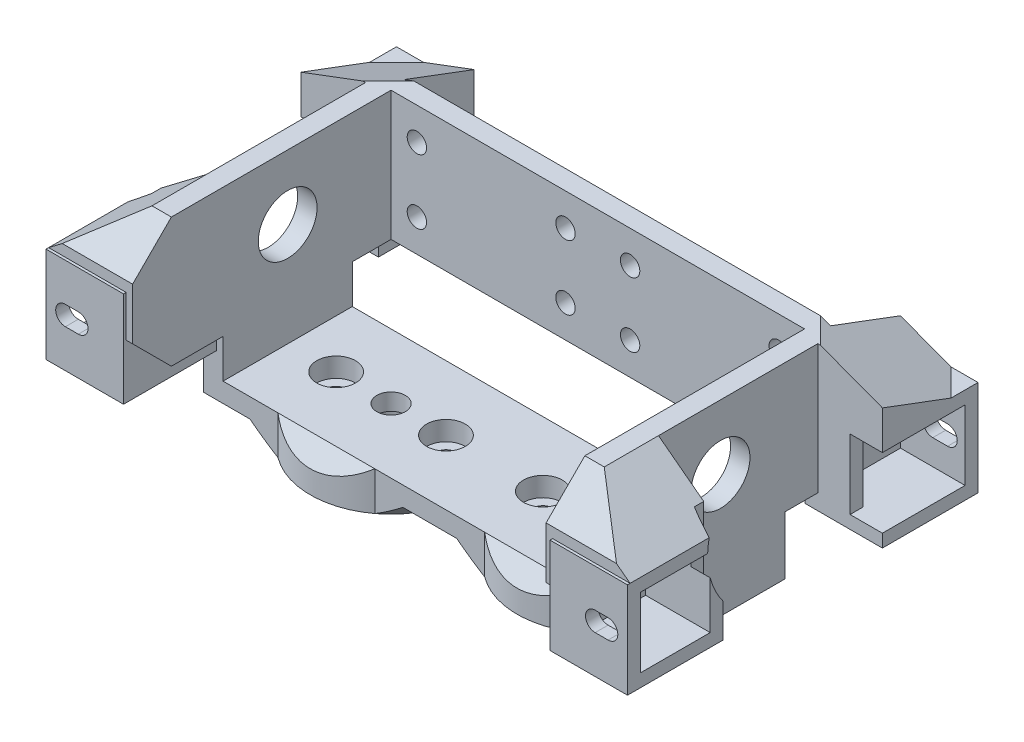
from build123d import *

# Parameters (mm, degrees)
SKETCH1_W            = 25
SKETCH1_H            = 20
BOSS_EXTRUDE1_DEPTH  = 3
SKETCH2_W            = 3
SKETCH2_H            = 20
BOSS_EXTRUDE2_DEPTH  = 40
SKETCH6_W            = 45
SKETCH6_H            = 20
BOSS_EXTRUDE3_DEPTH  = 3
SKETCH9_W            = 3
SKETCH9_H            = 20
BOSS_EXTRUDE4_DEPTH  = 40
SKETCH3_R            = 4.55
CUT_EXTRUDE1_DEPTH   = 83.758685345
CHAMFER1_SIZE        = 6
SKETCH17_W           = 14.8
SKETCH17_H           = 14.8
SKETCH17_W_2         = 10.8
SKETCH17_H_2         = 10.8
BOSS_EXTRUDE7_DEPTH  = 10
SKETCH18_W           = 14.8
SKETCH18_H           = 14.8
BOSS_EXTRUDE8_DEPTH  = 2
SKETCH21_W           = 14.8
SKETCH21_H           = 14.8
BOSS_EXTRUDE11_DEPTH = 2
BOSS_EXTRUDE12_REACH = 89.482
BOSS_EXTRUDE13_DEPTH = 7.6
CHAMFER4_SIZE        = 17
CHAMFER4_SIZE_2      = 9.039060338
CUT_EXTRUDE8_DEPTH   = 13
SKETCH26_R           = 12
CUT_EXTRUDE9_DEPTH   = 3
SKETCH27_W           = 2
SKETCH27_H           = 10.8
CUT_EXTRUDE10_DEPTH  = 3
CUT_EXTRUDE12_DEPTH  = 10
CUT_EXTRUDE13_START  = -10
CUT_EXTRUDE13_DEPTH  = 10
BOSS_EXTRUDE14_DEPTH = 3
SKETCH36_W           = 35
SKETCH36_H           = 20
SKETCH36_R           = 1.5
SKETCH36_R_2         = 2.2
BOSS_EXTRUDE15_DEPTH = 3
SKETCH37_R           = 12.5
SKETCH37_R_2         = 2.2
SKETCH37_R_3         = 1.5
BOSS_EXTRUDE16_DEPTH = 3
SKETCH38_R           = 3
CUT_EXTRUDE14_DEPTH  = 3
SKETCH39_R           = 3.7
CUT_EXTRUDE15_DEPTH  = 3.4
CHAMFER6_SIZE        = 3
CHAMFER7_SIZE        = 3
SKETCH40_W           = 2
SKETCH40_H           = 10.8
CUT_EXTRUDE16_DEPTH  = 2
SKETCH41_W           = 2
SKETCH41_H           = 10.8
CUT_EXTRUDE17_DEPTH  = 2
SKETCH50_R           = 1.5
CUT_EXTRUDE22_DEPTH  = 10


with BuildPart() as part:
    # Sketch1 → Boss-Extrude1 (new body)
    with BuildSketch(Plane.XY):
        Rectangle(SKETCH1_W, SKETCH1_H)
    extrude(amount=BOSS_EXTRUDE1_DEPTH)

    # Sketch2 → Boss-Extrude2 (add)
    with BuildSketch(Plane.XY.offset(3)):
        with Locations((-11, 0)):
            Rectangle(SKETCH2_W, SKETCH2_H)
    extrude(amount=BOSS_EXTRUDE2_DEPTH)

    # Sketch6 → Boss-Extrude3 (add)
    with BuildSketch(Plane(origin=(0, 0, 0), x_dir=(-1, 0, 0), z_dir=(0, 0, -1))):
        with Locations((-35, 0)):
            Rectangle(SKETCH6_W, SKETCH6_H)
    extrude(amount=-BOSS_EXTRUDE3_DEPTH)

    # Sketch9 → Boss-Extrude4 (add)
    with BuildSketch(Plane.XY.offset(3)):
        with Locations((56, 0)):
            Rectangle(SKETCH9_W, SKETCH9_H)
    extrude(amount=BOSS_EXTRUDE4_DEPTH)

    # Sketch3 → Cut-Extrude1 (cut, through all)
    with BuildSketch(Plane.ZY.offset(12.5)):
        with Locations(Location((19, 0, 0), (0, 0, 270))):
            Circle(SKETCH3_R)
    extrude(amount=-CUT_EXTRUDE1_DEPTH, mode=Mode.SUBTRACT)

    # Chamfer1
    chamfer1_edges = [part.edges().sort_by_distance(p)[0] for p in [
        (-11, -10, 43),
        (-11, 10, 43),
        (56, -10, 43),
        (56, 10, 43),
    ]]
    chamfer(chamfer1_edges, length=CHAMFER1_SIZE)

    # Sketch17 → Boss-Extrude7 (add)
    # profile 1 of 2: a face of its own
    with BuildSketch(Plane(origin=(57.5, 0, 0), x_dir=(0, 0, -1), z_dir=(1, 0, 0))):
        with Locations((3.445401219, -5)):
            Rectangle(SKETCH17_W, SKETCH17_H)
        with Locations((3.445401219, -5)):
            Rectangle(SKETCH17_W_2, SKETCH17_H_2, mode=Mode.SUBTRACT)
    # profile 2 of 2: a face of its own
    with BuildSketch(Plane(origin=(57.5, 0, 0), x_dir=(0, 0, -1), z_dir=(1, 0, 0))):
        with Locations((-36.004598781, -5)):
            Rectangle(SKETCH17_W, SKETCH17_H)
        with Locations((-36.004598781, -5)):
            Rectangle(SKETCH17_W_2, SKETCH17_H_2, mode=Mode.SUBTRACT)
    extrude(amount=BOSS_EXTRUDE7_DEPTH)

    # Sketch18 → Boss-Extrude8 (add)
    with BuildSketch(Plane.ZY.offset(-57.5)):
        with Locations((-3.445401219, -5)):
            Rectangle(SKETCH18_W, SKETCH18_H)
    extrude(amount=BOSS_EXTRUDE8_DEPTH)

    # Sketch21 → Boss-Extrude11 (add)
    with BuildSketch(Plane.ZY.offset(-57.5)):
        with Locations((36.004598781, -5)):
            Rectangle(SKETCH21_W, SKETCH21_H)
    extrude(amount=BOSS_EXTRUDE11_DEPTH)

    # Boss-Extrude12: up to this face of the body (flat: up to its plane)
    boss_extrude12_end = Plane(part.part.faces().sort_by_distance((62.311518325, -5.194764398, 28.604598781))[0])
    # Sketch22 → Boss-Extrude12 (add, up to the picked face)
    with BuildSketch(Plane.XY.offset(43.404598781), mode=Mode.PRIVATE) as boss_extrude12_sk1:
        Polygon((57.5, 2.4), (57.5, 10), (67.5, 2.4), align=None)
    boss_extrude12_tool1 = split(extrude(boss_extrude12_sk1.sketch, amount=-BOSS_EXTRUDE12_REACH, mode=Mode.PRIVATE), bisect_by=boss_extrude12_end, keep=Keep.BOTH, mode=Mode.PRIVATE)
    add(boss_extrude12_tool1.solids().sort_by(Axis((60.833333, 4.933333, 43.404599), (0, 0, -1)))[0])

    # Sketch23 → Boss-Extrude13 (add)
    with BuildSketch(Plane(origin=(0, 2.4, 0), x_dir=(1, 0, 0), z_dir=(0, 1, 0))):
        Polygon((55.5, 0), (57.5, 0), (57.5, -3.954598781), (67.5, -3.954598781), (67.5, 10.492881323), (67.147480104, 10.845401219), (55.5, 10.845401219), align=None)
    extrude(amount=BOSS_EXTRUDE13_DEPTH)

    # Chamfer4
    # the kernel refuses this chamfer: 17, 9.039060338 mm, written as the material it takes off along each edge
    with BuildSketch(Plane(origin=(98.618530871, 10, 20.625649548), x_dir=(-0.7071067811865565, 0, 0.7071067811865387), z_dir=(-0.7071067811865386, 0, -0.7071067811865565))) as chamfer4_piece_1_section:
        Polygon((CHAMFER4_SIZE, 0), (0, -CHAMFER4_SIZE_2), (0, 0), align=None)
    chamfer4_piece_1 = extrude(amount=88.515035216, mode=Mode.PRIVATE)
    chamfer4_piece_1 = split(chamfer4_piece_1, bisect_by=Plane(origin=(98.618530871, 2.4, 20.625649548), z_dir=(0, 1, 0)), keep=Keep.TOP, mode=Mode.PRIVATE)
    add(chamfer4_piece_1, mode=Mode.SUBTRACT)

    # Sketch24 → Cut-Extrude8 (cut)
    with BuildSketch(Plane.ZY.offset(-57.5)):
        Polygon((37, 10), (43.404598781, 10), (43.404598781, 2.4), (43, 2.4), (43, 4), align=None)
    extrude(amount=-CUT_EXTRUDE8_DEPTH, mode=Mode.SUBTRACT)

    # Sketch26 → Cut-Extrude9 (cut)
    with BuildSketch(Plane(origin=(67.5, 0, 0), x_dir=(0, 0, -1), z_dir=(1, 0, 0))):
        with Locations((-19, 0)):
            Circle(SKETCH26_R)
    extrude(amount=-CUT_EXTRUDE9_DEPTH, mode=Mode.SUBTRACT)

    # Mirror3: read off the stored shape, not the designer's step
    # Mirror3
    split(bisect_by=Plane.ZY.offset(-22.5), keep=Keep.BOTTOM)

    # Mirror3 2: part across plane


with BuildPart() as part_1:
    add(part.part)
    add(part.part.mirror(Plane.ZY.offset(-22.5)))

    # Sketch27 → Cut-Extrude10 (cut)
    with BuildSketch(Plane.ZY.offset(22.5)):
        with Locations((2.954598781, -5)):
            Rectangle(SKETCH27_W, SKETCH27_H)
    cut_extrude10 = extrude(amount=-CUT_EXTRUDE10_DEPTH, mode=Mode.SUBTRACT)

    # Mirror4: Cut-Extrude10 across plane
    add(cut_extrude10.mirror(Plane.ZY.offset(-22.5)), mode=Mode.SUBTRACT)

    # Sketch32 → Cut-Extrude12 (cut)
    with BuildSketch(Plane(origin=(0, 0, -10.845401219), x_dir=(-1, 0, 0), z_dir=(0, 0, -1))):
        with BuildLine():
            Line((19.790168373, -6.5), (17.5, -6.5))
            ThreePointArc((17.5, -6.5), (16, -5), (17.5, -3.5))
            Line((17.5, -3.5), (19.790168373, -3.5))
            ThreePointArc((19.790168373, -3.5), (21.290168373, -5), (19.790168373, -6.5))
        make_face()
        with BuildLine():
            Line((-64.790168373, -6.5), (-62.5, -6.5))
            ThreePointArc((-62.5, -6.5), (-61, -5), (-62.5, -3.5))
            Line((-62.5, -3.5), (-64.790168373, -3.5))
            ThreePointArc((-64.790168373, -3.5), (-66.290168373, -5), (-64.790168373, -6.5))
        make_face()
    extrude(amount=-CUT_EXTRUDE12_DEPTH, mode=Mode.SUBTRACT)

    # Sketch33 → Cut-Extrude13 (cut)
    with BuildSketch(Plane.XY.offset(43.404598781).offset(CUT_EXTRUDE13_START)):
        with BuildLine():
            Line((62.5, -3.5), (64.5, -3.5))
            ThreePointArc((64.5, -3.5), (66, -5), (64.5, -6.5))
            Line((64.5, -6.5), (62.5, -6.5))
            ThreePointArc((62.5, -6.5), (61, -5), (62.5, -3.5))
        make_face()
        with BuildLine():
            Line((-17.5, -6.5), (-19.5, -6.5))
            ThreePointArc((-19.5, -6.5), (-21, -5), (-19.5, -3.5))
            Line((-19.5, -3.5), (-17.5, -3.5))
            ThreePointArc((-17.5, -3.5), (-16, -5), (-17.5, -6.5))
        make_face()
    extrude(amount=CUT_EXTRUDE13_DEPTH, mode=Mode.SUBTRACT)

    # Sketch35 → Boss-Extrude14 (add)
    with BuildSketch(Plane(origin=(-9.5, 0, 0), x_dir=(0, 0, -1), z_dir=(1, 0, 0))):
        Polygon((-19, -16), (-29, -16), (-29, -10), (-9, -10), (-9, -16), align=None)
    boss_extrude14 = extrude(amount=-BOSS_EXTRUDE14_DEPTH)

    # Sketch36 → Boss-Extrude15 (add)
    with BuildSketch(Plane.XZ.offset(16)):
        with Locations((5, 19)):
            Rectangle(SKETCH36_W, SKETCH36_H)
        with Locations((15, 19)):
            Circle(SKETCH36_R, mode=Mode.SUBTRACT)
        with Locations((-2, 19)):
            Circle(SKETCH36_R, mode=Mode.SUBTRACT)
        with Locations((6.5, 19)):
            Circle(SKETCH36_R_2, mode=Mode.SUBTRACT)
    boss_extrude15 = extrude(amount=BOSS_EXTRUDE15_DEPTH)

    # Sketch37 → Boss-Extrude16 (add)
    with BuildSketch(Plane.XZ.offset(19)):
        with Locations(Location((6.5, 19, 0), (0, 0, 126.869897646))):
            Circle(SKETCH37_R)
        with Locations((6.5, 19)):
            Circle(SKETCH37_R_2, mode=Mode.SUBTRACT)
        with Locations((-2, 19)):
            Circle(SKETCH37_R_3, mode=Mode.SUBTRACT)
        with Locations((15, 19)):
            Circle(SKETCH37_R_3, mode=Mode.SUBTRACT)
    boss_extrude16 = extrude(amount=BOSS_EXTRUDE16_DEPTH)

    # Sketch38 → Cut-Extrude14 (cut)
    with BuildSketch(Plane(origin=(0, -16, 0), x_dir=(1, 0, 0), z_dir=(0, 1, 0))):
        with Locations(Location((-2, -19, 0), (0, 0, 180))):
            Circle(SKETCH38_R)
        with Locations(Location((15, -19, 0), (0, 0, 180))):
            Circle(SKETCH38_R)
    cut_extrude14 = extrude(amount=-CUT_EXTRUDE14_DEPTH, mode=Mode.SUBTRACT)

    # Sketch39 → Cut-Extrude15 (cut)
    with BuildSketch(Plane(origin=(0, -22, 0), x_dir=(-1, 0, 0), z_dir=(0, -1, 0))):
        with Locations(Location((-6.5, -19, 0), (0, 0, 180))):
            Circle(SKETCH39_R)
    cut_extrude15 = extrude(amount=-CUT_EXTRUDE15_DEPTH, mode=Mode.SUBTRACT)

    # Mirror5: Boss-Extrude14, Boss-Extrude15, Boss-Extrude16, Cut-Extrude14, Cut-Extrude15 across plane
    add(boss_extrude14.mirror(Plane(origin=(22.5, -19, 0), x_dir=(0, 0, 1), z_dir=(1, 0, 0))))
    add(boss_extrude15.mirror(Plane(origin=(22.5, -19, 0), x_dir=(0, 0, 1), z_dir=(1, 0, 0))))
    add(boss_extrude16.mirror(Plane(origin=(22.5, -19, 0), x_dir=(0, 0, 1), z_dir=(1, 0, 0))))
    add(cut_extrude14.mirror(Plane(origin=(22.5, -19, 0), x_dir=(0, 0, 1), z_dir=(1, 0, 0))), mode=Mode.SUBTRACT)
    add(cut_extrude15.mirror(Plane(origin=(22.5, -19, 0), x_dir=(0, 0, 1), z_dir=(1, 0, 0))), mode=Mode.SUBTRACT)

    # Chamfer6
    # the kernel refuses this chamfer: 3 mm, written as the material it adds along each edge
    with BuildSketch(Plane(origin=(6.5, -19, 19), x_dir=(0.02594862310488829, 0, -0.9996632777885565), z_dir=(-0.9996632777885565, 0, -0.02594862310488829))) as chamfer6_piece_1_section:
        Polygon((12.5 + CHAMFER6_SIZE, 0), (12.5, CHAMFER6_SIZE), (12.5, 0), align=None)
    chamfer6_piece_1 = revolve(axis=Axis((6.5, -19, 19), (0, -1, 0)), revolution_arc=177.026173032, mode=Mode.PRIVATE)
    chamfer6_piece_1 = split(chamfer6_piece_1, bisect_by=Plane(origin=(6.5, -19, 29), z_dir=(0, 0, -1)), keep=Keep.TOP, mode=Mode.PRIVATE)
    chamfer6_piece_1 = split(chamfer6_piece_1, bisect_by=Plane(origin=(6.5, -19, 9), z_dir=(0, 0, 1)), keep=Keep.TOP, mode=Mode.PRIVATE)
    add(chamfer6_piece_1)
    with BuildSketch(Plane(origin=(6.5, -19, 19), x_dir=(-0.02594862310756071, 0, 0.9996632777884871), z_dir=(0.9996632777884871, 0, 0.02594862310756071))) as chamfer6_piece_2_section:
        Polygon((12.5 + CHAMFER6_SIZE, 0), (12.5, CHAMFER6_SIZE), (12.5, 0), align=None)
    chamfer6_piece_2 = revolve(axis=Axis((6.5, -19, 19), (0, -1, 0)), revolution_arc=177.026173032, mode=Mode.PRIVATE)
    chamfer6_piece_2 = split(chamfer6_piece_2, bisect_by=Plane(origin=(6.5, -19, 29), z_dir=(0, 0, -1)), keep=Keep.TOP, mode=Mode.PRIVATE)
    chamfer6_piece_2 = split(chamfer6_piece_2, bisect_by=Plane(origin=(6.5, -19, 9), z_dir=(0, 0, 1)), keep=Keep.TOP, mode=Mode.PRIVATE)
    add(chamfer6_piece_2)
    with BuildSketch(Plane(origin=(38.5, -19, 19), x_dir=(-0.02594862310490669, 0, -0.9996632777885559), z_dir=(0.9996632777885559, 0, -0.02594862310490669))) as chamfer6_piece_3_section:
        Polygon((12.5 + CHAMFER6_SIZE, 0), (12.5, -CHAMFER6_SIZE), (12.5, 0), align=None)
    chamfer6_piece_3 = revolve(axis=Axis((38.5, -19, 19), (0, 1, 0)), revolution_arc=177.026173032, mode=Mode.PRIVATE)
    chamfer6_piece_3 = split(chamfer6_piece_3, bisect_by=Plane(origin=(38.5, -19, 29), z_dir=(0, 0, -1)), keep=Keep.TOP, mode=Mode.PRIVATE)
    chamfer6_piece_3 = split(chamfer6_piece_3, bisect_by=Plane(origin=(38.5, -19, 9), z_dir=(0, 0, 1)), keep=Keep.TOP, mode=Mode.PRIVATE)
    add(chamfer6_piece_3)
    with BuildSketch(Plane(origin=(38.5, -19, 19), x_dir=(0.025948623107560718, 0, 0.9996632777884871), z_dir=(-0.9996632777884871, 0, 0.025948623107560718))) as chamfer6_piece_4_section:
        Polygon((12.5 + CHAMFER6_SIZE, 0), (12.5, -CHAMFER6_SIZE), (12.5, 0), align=None)
    chamfer6_piece_4 = revolve(axis=Axis((38.5, -19, 19), (0, 1, 0)), revolution_arc=177.026173032, mode=Mode.PRIVATE)
    chamfer6_piece_4 = split(chamfer6_piece_4, bisect_by=Plane(origin=(38.5, -19, 29), z_dir=(0, 0, -1)), keep=Keep.TOP, mode=Mode.PRIVATE)
    chamfer6_piece_4 = split(chamfer6_piece_4, bisect_by=Plane(origin=(38.5, -19, 9), z_dir=(0, 0, 1)), keep=Keep.TOP, mode=Mode.PRIVATE)
    add(chamfer6_piece_4)

    # Chamfer7
    # the kernel refuses this chamfer: 3 mm, written as the material it adds along each edge
    with BuildSketch(Plane(origin=(23.284951036, -19, 29), x_dir=(0, 1, 0), z_dir=(1, 0, 0))) as chamfer7_piece_1_section:
        Polygon((CHAMFER7_SIZE, 0), (0, CHAMFER7_SIZE), (0, 0), align=None)
    chamfer7_piece_1 = extrude(amount=30.430097928, mode=Mode.PRIVATE)
    chamfer7_piece_1 = chamfer7_piece_1 & Plane(origin=(38.5, -19, 19), x_dir=(0.6000000000021779, 0, 0.7999999999983666), z_dir=(0, 1, 0)) * Cylinder(12.5, 73, mode=Mode.PRIVATE)
    add(chamfer7_piece_1)
    with BuildSketch(Plane(origin=(53.715048964, -19, 9), x_dir=(0, 1, 0), z_dir=(-1, 0, 0))) as chamfer7_piece_2_section:
        Polygon((CHAMFER7_SIZE, 0), (0, CHAMFER7_SIZE), (0, 0), align=None)
    chamfer7_piece_2 = extrude(amount=30.430097928, mode=Mode.PRIVATE)
    chamfer7_piece_2 = chamfer7_piece_2 & Plane(origin=(38.5, -19, 19), x_dir=(0.6000000000021779, 0, 0.7999999999983666), z_dir=(0, 1, 0)) * Cylinder(12.5, 73, mode=Mode.PRIVATE)
    add(chamfer7_piece_2)
    with BuildSketch(Plane(origin=(21.715048964, -19, 29), x_dir=(0, 1, 0), z_dir=(-1, 0, 0))) as chamfer7_piece_3_section:
        Polygon((CHAMFER7_SIZE, 0), (0, -CHAMFER7_SIZE), (0, 0), align=None)
    chamfer7_piece_3 = extrude(amount=30.430097928, mode=Mode.PRIVATE)
    chamfer7_piece_3 = chamfer7_piece_3 & Plane(origin=(6.5, -19, 19), x_dir=(-0.6000000000021777, 0, 0.7999999999983668), z_dir=(0, 1, 0)) * Cylinder(12.5, 73, mode=Mode.PRIVATE)
    add(chamfer7_piece_3)
    with BuildSketch(Plane(origin=(-8.715048964, -19, 9), x_dir=(0, 1, 0), z_dir=(1, 0, 0))) as chamfer7_piece_4_section:
        Polygon((CHAMFER7_SIZE, 0), (0, -CHAMFER7_SIZE), (0, 0), align=None)
    chamfer7_piece_4 = extrude(amount=30.430097928, mode=Mode.PRIVATE)
    chamfer7_piece_4 = chamfer7_piece_4 & Plane(origin=(6.5, -19, 19), x_dir=(-0.6000000000021777, 0, 0.7999999999983668), z_dir=(0, 1, 0)) * Cylinder(12.5, 73, mode=Mode.PRIVATE)
    add(chamfer7_piece_4)

    # Sketch40 → Cut-Extrude16 (cut)
    with BuildSketch(Plane(origin=(64.5, 0, 0), x_dir=(0, 0, -1), z_dir=(1, 0, 0))):
        with Locations((-2.954598781, -5)):
            Rectangle(SKETCH40_W, SKETCH40_H)
    extrude(amount=-CUT_EXTRUDE16_DEPTH, mode=Mode.SUBTRACT)

    # Sketch41 → Cut-Extrude17 (cut)
    with BuildSketch(Plane.ZY.offset(19.5)):
        with Locations((2.954598781, -5)):
            Rectangle(SKETCH41_W, SKETCH41_H)
    extrude(amount=-CUT_EXTRUDE17_DEPTH, mode=Mode.SUBTRACT)

    # Sketch50 → Cut-Extrude22 (cut)
    with BuildSketch(Plane(origin=(0, 0, 0), x_dir=(-1, 0, 0), z_dir=(0, 0, -1))):
        with Locations((5.5, 5)):
            Circle(SKETCH50_R)
        with Locations((5.5, -5)):
            Circle(SKETCH50_R)
        with Locations((-50.5, -5)):
            Circle(SKETCH50_R)
        with Locations((-50.5, 5)):
            Circle(SKETCH50_R)
        with Locations((-27.5, 5)):
            Circle(SKETCH50_R)
        with Locations((-27.5, -5)):
            Circle(SKETCH50_R)
        with Locations((-17.5, -5)):
            Circle(SKETCH50_R)
        with Locations((-17.5, 5)):
            Circle(SKETCH50_R)
    extrude(amount=-CUT_EXTRUDE22_DEPTH, mode=Mode.SUBTRACT)


solid = part_1.part
